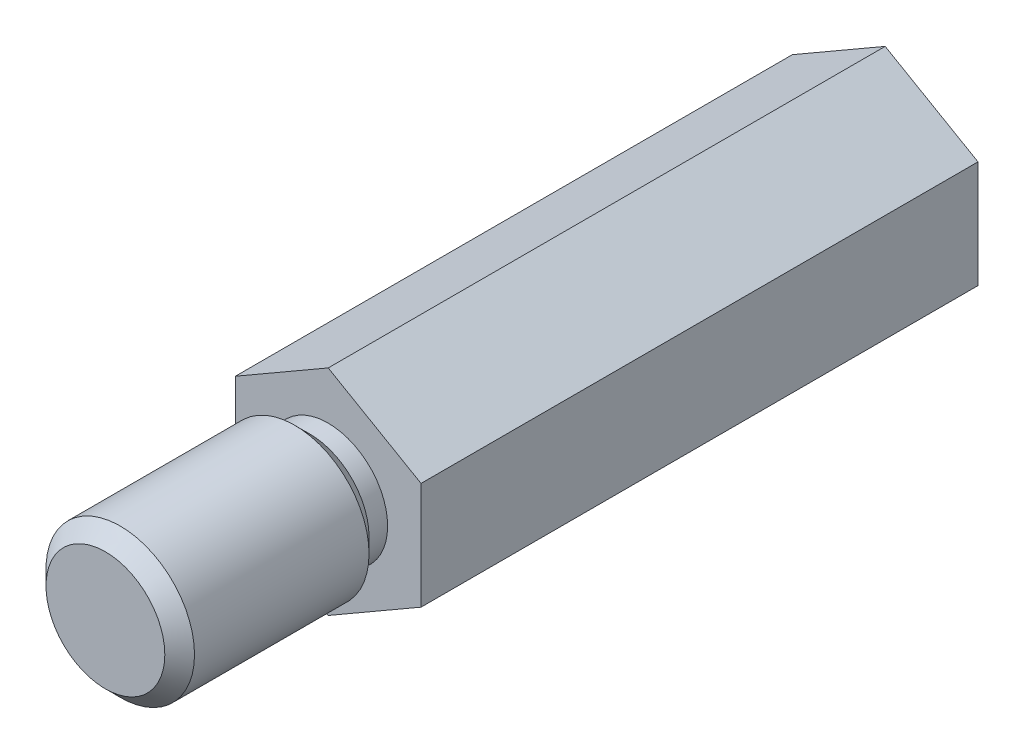
from build123d import *

# Parameters (mm, degrees)
EXTRUDE_1_DEPTH     = 15
SKETCH_2_R          = 2
EXTRUDE_2_DEPTH     = 6
SKETCH_3_R          = 2
SKETCH_3_R_2        = 1.6
CUT_EXTRUDE_3_DEPTH = 0.5
CHAMFER_1_SIZE      = 0.4


with BuildPart() as part:
    # Эскиз1 → Вытянуть1 (new body)
    with BuildSketch(Plane.XY):
        Polygon((0, 2.886751346), (-2.5, 1.443375673), (-2.5, -1.443375673), (0, -2.886751346), (2.5, -1.443375673), (2.5, 1.443375673), align=None)
    extrude(amount=EXTRUDE_1_DEPTH)

    # Эскиз2 → Вытянуть2 (add)
    with BuildSketch(Plane.XY.offset(15)):
        Circle(SKETCH_2_R)
    extrude(amount=EXTRUDE_2_DEPTH)

    # Эскиз3 → Вырез-Вытянуть3 (cut)
    with BuildSketch(Plane.XY.offset(15)):
        Circle(SKETCH_3_R)
        Circle(SKETCH_3_R_2, mode=Mode.SUBTRACT)
    extrude(amount=CUT_EXTRUDE_3_DEPTH, mode=Mode.SUBTRACT)

    # Фаска1
    chamfer_1_edges = [part.edges().sort_by_distance(p)[0] for p in [
        (-2, 0, 21),
        (-2, 0, 15.5),
    ]]
    chamfer(chamfer_1_edges, length=CHAMFER_1_SIZE - 0.0001)  # a hair under: the kernel refuses the full size


solid = part.part
